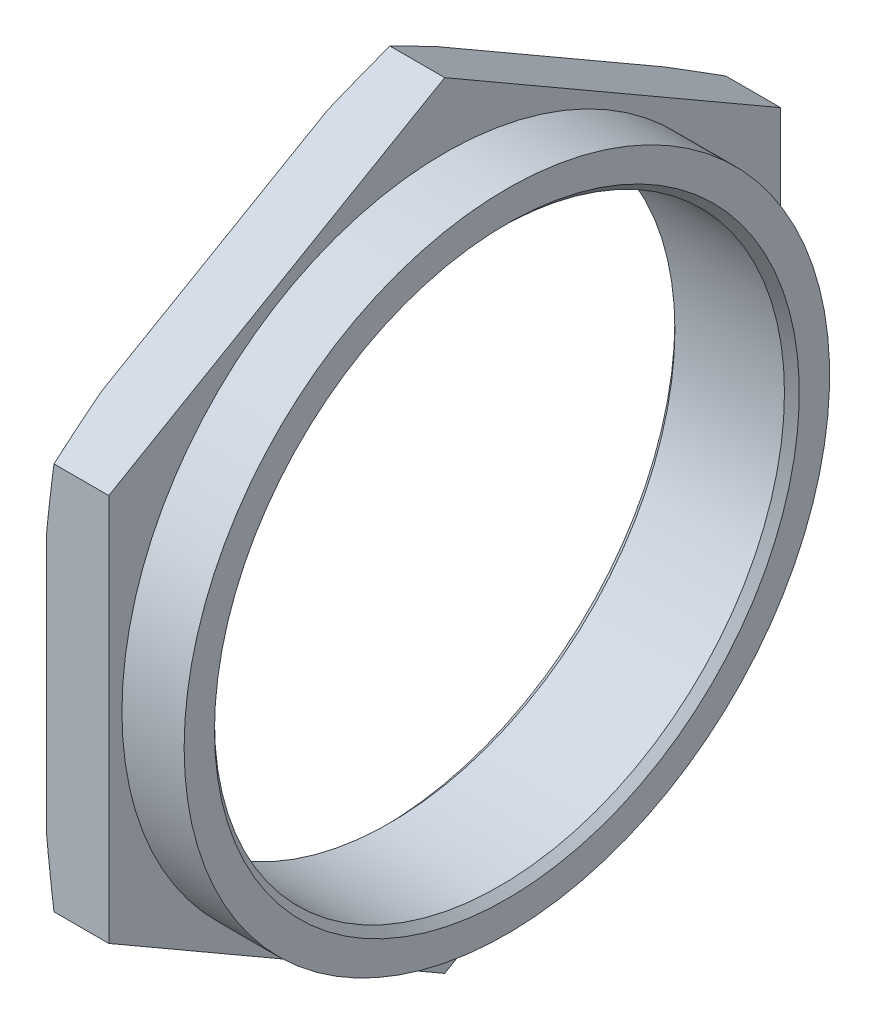
from build123d import *

# Parameters (mm, degrees)
CHAMFER1_SIZE  = 0.5
CHAMFER1_SIZE2 = 1.866025404
SKETCH2_R      = 30.350258036
EXTRUDE1_DEPTH = 38.992630864
CHAMFER2_SIZE  = 0.5


with BuildPart() as part:
    # Sketch1 → Revolve1 (revolve)
    with BuildSketch(Plane.XY):
        Polygon((0, 19.25), (0, 26.2), (4.2, 26.2), (4.2, 21.8), (8.4, 21.8), (8.4, 19.25), align=None)
    revolve(axis=Axis((0, 0, 0), (1, 0, 0)))

    # Chamfer1
    chamfer1_edges = [part.edges().sort_by_distance(p)[0] for p in [
        (0, -26.2, 0),
    ]]
    chamfer1_side = [part.faces().sort_by_distance(p)[0] for p in [
        (2.1, -26.2, 0),
    ]]
    chamfer(chamfer1_edges, length=CHAMFER1_SIZE, length2=CHAMFER1_SIZE2, reference=chamfer1_side[0])

    # Sketch2 → Extrude1 (cut, through all)
    with BuildSketch(Plane.ZY):
        Circle(SKETCH2_R)
        Polygon((0, 26.2), (-22.689865579, 13.1), (-22.689865579, -13.1), (0, -26.2), (22.689865579, -13.1), (22.689865579, 13.1), align=None, mode=Mode.SUBTRACT)
    extrude(amount=-EXTRUDE1_DEPTH, mode=Mode.SUBTRACT)

    # Chamfer2
    chamfer2_edges = [part.edges().sort_by_distance(p)[0] for p in [
        (8.4, -19.25, 0),
        (0, -19.25, 0),
    ]]
    chamfer(chamfer2_edges, length=CHAMFER2_SIZE)


solid = part.part
